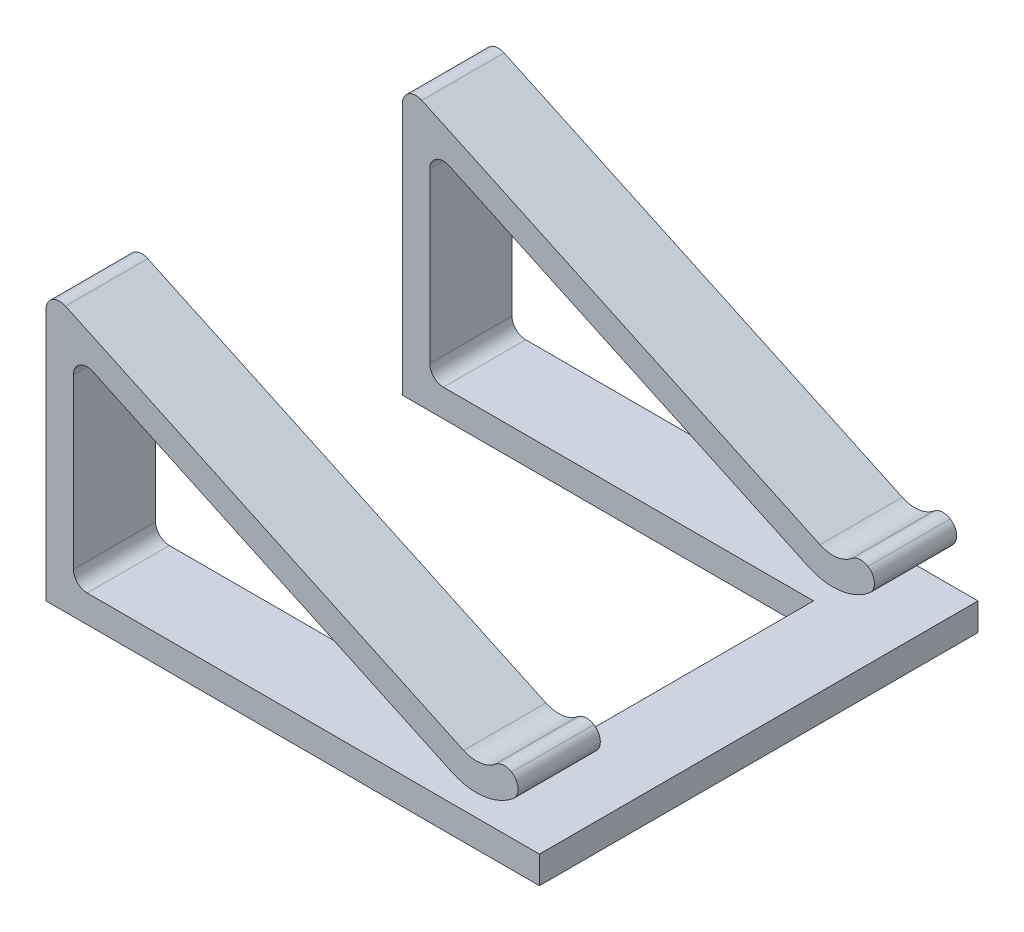
from build123d import *

# Parameters (mm, degrees)
EXTRUDE_THIN1_DEPTH = 15
SKETCH5_W           = 30
SKETCH5_H           = 10
BOSS_EXTRUDE2_DEPTH = 160
FILLET15_R          = 5


with BuildPart() as part:
    # Sketch2 → Extrude-Thin1 (new, symmetric)
    with BuildSketch(Plane.XY):
        with BuildLine():
            ThreePointArc((166.330603598, 33.062927418), (160.12783844, 28.366835098), (152.36969162, 28.948845927))
            Line((152.36969162, 28.948845927), (0, 100))
            Line((0, 100), (0, 0))
            Line((0, 0), (150, 0))
            Line((150, 0), (150, 10))
            Line((150, 10), (10, 10))
            Line((10, 10), (10, 84.303144229))
            Line((10, 84.303144229), (148.143509003, 19.885768057))
            ThreePointArc((148.143509003, 19.885768057), (162.954516568, 18.774656473), (174.796159143, 27.73992363))
            Line((174.796159143, 27.73992363), (166.330603598, 33.062927418))
        make_face()
    extrude_thin1 = extrude(amount=EXTRUDE_THIN1_DEPTH, both=True)

    # Sketch5 → Boss-Extrude2 (add)
    with BuildSketch(Plane.XY.offset(15)):
        with Locations((165, 5)):
            Rectangle(SKETCH5_W, SKETCH5_H)
    extrude(amount=-BOSS_EXTRUDE2_DEPTH)

    # Mirror1: Extrude-Thin1 across plane
    add(extrude_thin1.mirror(Plane.XY.offset(-65)))

    # Fillet15
    fillet15_edges = [part.edges().sort_by_distance(p)[0] for p in [
        (0, 100, 0),
        (0, 100, -130),
        (174.796159143, 27.73992363, -130),
        (166.330603598, 33.062927418, -130),
        (10, 10, -130),
        (10, 84.303144229, -130),
        (10, 84.303144229, 0),
        (10, 10, 0),
        (174.796159143, 27.73992363, 0),
        (166.330603598, 33.062927418, 0),
    ]]
    fillet(fillet15_edges, radius=FILLET15_R - 0.0001)  # a hair under: the kernel refuses the full size


solid = part.part
